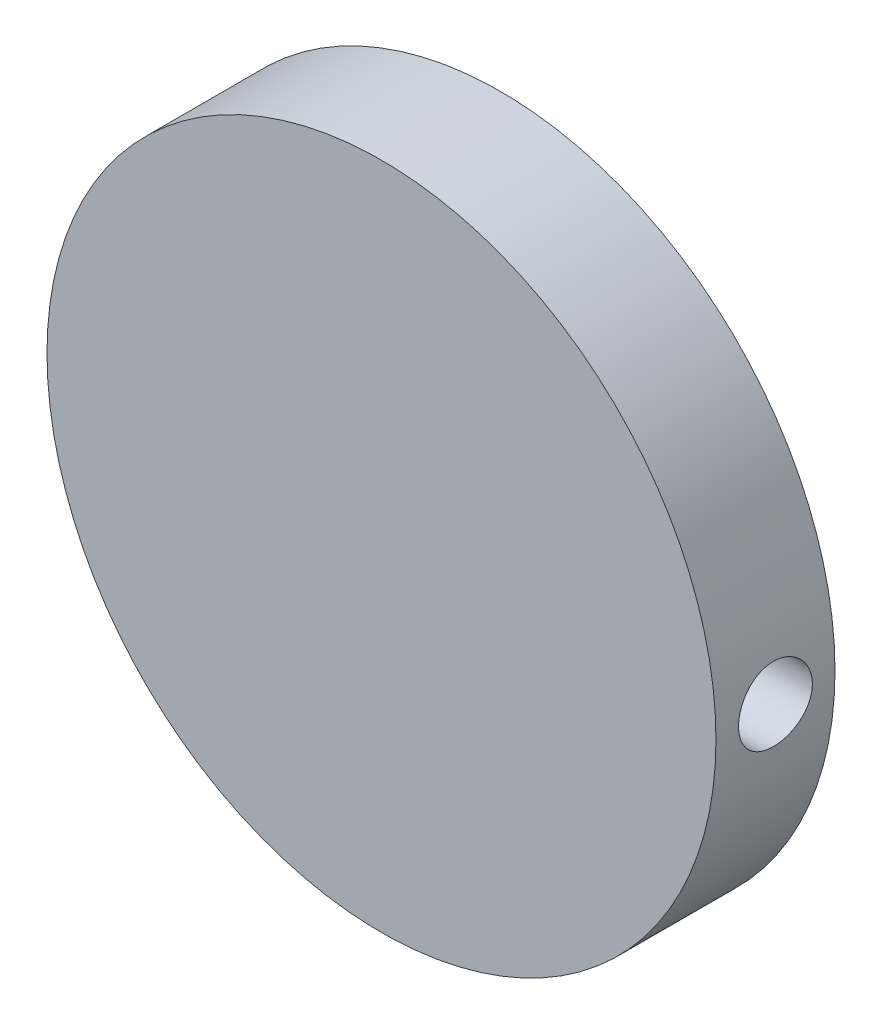
from build123d import *

# Parameters (mm, degrees)
SKETCH1_R               = 14.05
EXTRUDE1_DEPTH          = 5
CUT_EXTRUDE1_DEPTH      = 21.489143467
CUT_EXTRUDE1_DEPTH_BACK = 21.489143467
SKETCH2_R               = 1.55
SKETCH3_R               = 11.1125
CUT_EXTRUDE2_DEPTH      = 2.5


with BuildPart() as part:
    # Sketch1 → Extrude1 (new body)
    with BuildSketch(Plane.XY):
        Circle(SKETCH1_R)
    extrude(amount=EXTRUDE1_DEPTH)

    # Sketch2 → Cut-Extrude1 (cut, two sides: drawn at the far end of the back side and taken through both)
    with BuildSketch(Plane(origin=(0, 0, 0), x_dir=(0, 0, -1), z_dir=(1, 0, 0)).offset(-CUT_EXTRUDE1_DEPTH_BACK)):
        with Locations((-2.5, 0)):
            Circle(SKETCH2_R)
    extrude(amount=CUT_EXTRUDE1_DEPTH + CUT_EXTRUDE1_DEPTH_BACK, mode=Mode.SUBTRACT)

    # Sketch3 → Cut-Extrude2 (cut)
    with BuildSketch(Plane(origin=(0, 0, 0), x_dir=(-1, 0, 0), z_dir=(0, 0, -1))):
        Circle(SKETCH3_R)
    extrude(amount=-CUT_EXTRUDE2_DEPTH, mode=Mode.SUBTRACT)


solid = part.part
